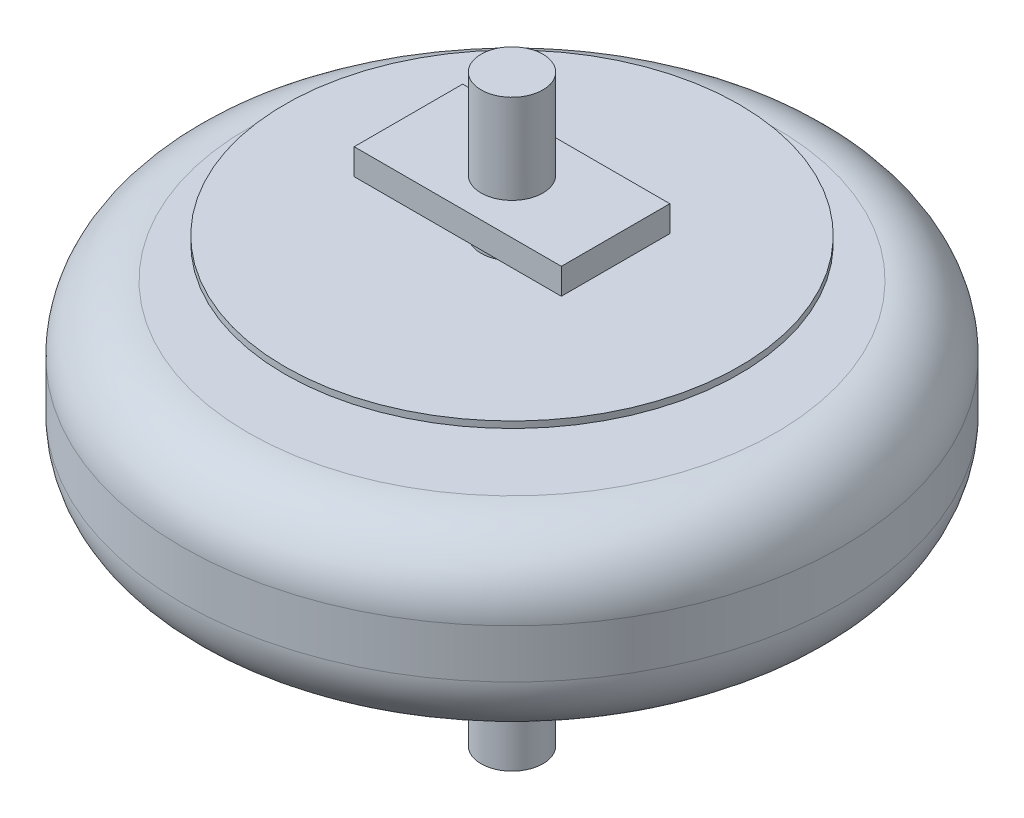
from build123d import *

# Parameters (mm, degrees)
SKETCH1_R                = 101.6
BOSS_EXTRUDE1_DEPTH      = 27.813
BOSS_EXTRUDE2_DEPTH      = 55.626
BOSS_EXTRUDE2_DEPTH_BACK = 124.206
SKETCH2_R                = 9.525
FILLET1_R                = 20.32
SKETCH4_R                = 70
BOSS_EXTRUDE4_DEPTH      = 2
SKETCH5_W                = 63.825847526
SKETCH5_H                = 33.413187296
BOSS_EXTRUDE5_DEPTH      = 8


with BuildPart() as part:
    # Sketch1 → Boss-Extrude1 (new, symmetric)
    with BuildSketch(Plane(origin=(0, 0, 0), x_dir=(1, 0, 0), z_dir=(0, 1, 0))):
        Circle(SKETCH1_R)
    extrude(amount=BOSS_EXTRUDE1_DEPTH, both=True)

    # Sketch2 → Boss-Extrude2 (add, two sides: drawn at the far end of the back side and taken through both)
    with BuildSketch(Plane(origin=(0, 27.813, 0), x_dir=(1, 0, 0), z_dir=(0, 1, 0)).offset(-BOSS_EXTRUDE2_DEPTH_BACK)):
        Circle(SKETCH2_R)
    extrude(amount=BOSS_EXTRUDE2_DEPTH + BOSS_EXTRUDE2_DEPTH_BACK)

    # Fillet1
    fillet1_edges = [part.edges().sort_by_distance(p)[0] for p in [
        (-101.6, -27.813, 0),
        (-101.6, 27.813, 0),
    ]]
    fillet(fillet1_edges, radius=FILLET1_R)

    # Sketch4 → Boss-Extrude4 (add)
    with BuildSketch(Plane(origin=(0, 37.813000066, 0), x_dir=(1, 0, 0), z_dir=(0, 1, 0))):
        Circle(SKETCH4_R)
    extrude(amount=BOSS_EXTRUDE4_DEPTH)

    # Sketch5 → Boss-Extrude5 (add)
    with BuildSketch(Plane(origin=(0, 55.913000066, 0), x_dir=(1, 0, 0), z_dir=(0, 1, 0))):
        Rectangle(SKETCH5_W, SKETCH5_H)
    extrude(amount=-BOSS_EXTRUDE5_DEPTH)


solid = part.part
